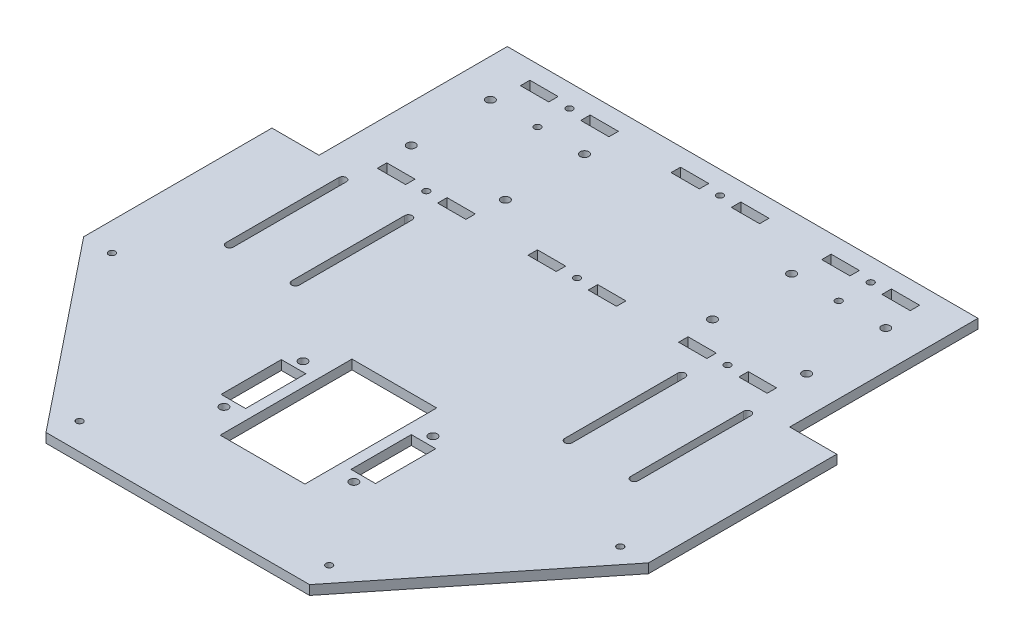
from build123d import *

# Parameters (mm, degrees)
SKETCH_2_R          = 2.25
EXTRUDE_2_DEPTH     = 5
SKETCH_3_W          = 25
SKETCH_3_H          = 100
CUT_EXTRUDE_1_DEPTH = 5
CUT_EXTRUDE_2_DEPTH = 5
SKETCH_5_R          = 1.75
SKETCH_5_W          = 15
SKETCH_5_H          = 5
CUT_EXTRUDE_3_DEPTH = 213.190951739
SKETCH_7_R          = 2.25
SKETCH_7_W          = 13
SKETCH_7_H          = 32
SKETCH_7_W_2        = 45
SKETCH_7_H_2        = 70
CUT_EXTRUDE_4_DEPTH = 10
SKETCH_8_R          = 1.75
CUT_EXTRUDE_5_DEPTH = 213.190951739


with BuildPart() as part:
    # 草圖2 → 填料-伸長2 (new body)
    with BuildSketch(Plane(origin=(0, 0, 0), x_dir=(1, 0, 0), z_dir=(0, 1, 0))):
        Polygon((-150, 150), (150, 150), (150, -50), (70, -150), (-70, -150), (-150, -50), align=None)
        with Locations((-105, 121)):
            Circle(SKETCH_2_R, mode=Mode.SUBTRACT)
        with Locations((-105, 79)):
            Circle(SKETCH_2_R, mode=Mode.SUBTRACT)
        with Locations((-55, 79)):
            Circle(SKETCH_2_R, mode=Mode.SUBTRACT)
        with Locations((-55, 121)):
            Circle(SKETCH_2_R, mode=Mode.SUBTRACT)
        with Locations((55, 121)):
            Circle(SKETCH_2_R, mode=Mode.SUBTRACT)
        with Locations((55, 79)):
            Circle(SKETCH_2_R, mode=Mode.SUBTRACT)
        with Locations((105, 121)):
            Circle(SKETCH_2_R, mode=Mode.SUBTRACT)
        with Locations((105, 79)):
            Circle(SKETCH_2_R, mode=Mode.SUBTRACT)
    extrude(amount=EXTRUDE_2_DEPTH)

    # 草圖3 → 除料-伸長1 (cut)
    with BuildSketch(Plane(origin=(0, 5, 0), x_dir=(1, 0, 0), z_dir=(0, 1, 0))):
        with Locations((-137.5, 100)):
            Rectangle(SKETCH_3_W, SKETCH_3_H)
        with Locations((137.5, 100)):
            Rectangle(SKETCH_3_W, SKETCH_3_H)
    extrude(amount=-CUT_EXTRUDE_1_DEPTH, mode=Mode.SUBTRACT)

    # 草圖4 → 除料-伸長2 (cut)
    with BuildSketch(Plane(origin=(0, 5, 0), x_dir=(1, 0, 0), z_dir=(0, 1, 0))):
        with BuildLine():
            Line((-105.5, 45), (-105.5, -15))
            ThreePointArc((-105.5, -15), (-107.5, -17), (-109.5, -15))
            Line((-109.5, -15), (-109.5, 45))
            ThreePointArc((-109.5, 45), (-107.5, 47), (-105.5, 45))
        make_face()
        with BuildLine():
            Line((-74.5, 45), (-74.5, -15))
            ThreePointArc((-74.5, -15), (-72.5, -17), (-70.5, -15))
            Line((-70.5, -15), (-70.5, 45))
            ThreePointArc((-70.5, 45), (-72.5, 47), (-74.5, 45))
        make_face()
        with BuildLine():
            Line((105.5, 45), (105.5, -15))
            ThreePointArc((105.5, -15), (107.5, -17), (109.5, -15))
            Line((109.5, -15), (109.5, 45))
            ThreePointArc((109.5, 45), (107.5, 47), (105.5, 45))
        make_face()
        with BuildLine():
            Line((74.5, 45), (74.5, -15))
            ThreePointArc((74.5, -15), (72.5, -17), (70.5, -15))
            Line((70.5, -15), (70.5, 45))
            ThreePointArc((70.5, 45), (72.5, 47), (74.5, 45))
        make_face()
    extrude(amount=-CUT_EXTRUDE_2_DEPTH, mode=Mode.SUBTRACT)

    # 草圖5 → 除料-伸長3 (cut, through all)
    with BuildSketch(Plane(origin=(0, 5, 0), x_dir=(1, 0, 0), z_dir=(0, 1, 0))):
        with Locations((0, 62)):
            Circle(SKETCH_5_R)
        with Locations((-80, 62)):
            Circle(SKETCH_5_R)
        with Locations((80, 62)):
            Circle(SKETCH_5_R)
        with Locations((80, 138)):
            Circle(SKETCH_5_R)
        with Locations((-80, 138)):
            Circle(SKETCH_5_R)
        with Locations((0, 138)):
            Circle(SKETCH_5_R)
        with Locations((16, 62)):
            Rectangle(SKETCH_5_W, SKETCH_5_H)
        with Locations((-16, 62)):
            Rectangle(SKETCH_5_W, SKETCH_5_H)
        with Locations((-96, 62)):
            Rectangle(SKETCH_5_W, SKETCH_5_H)
        with Locations((-64, 62)):
            Rectangle(SKETCH_5_W, SKETCH_5_H)
        with Locations((64, 62)):
            Rectangle(SKETCH_5_W, SKETCH_5_H)
        with Locations((96, 62)):
            Rectangle(SKETCH_5_W, SKETCH_5_H)
        with Locations((96, 138)):
            Rectangle(SKETCH_5_W, SKETCH_5_H)
        with Locations((64, 138)):
            Rectangle(SKETCH_5_W, SKETCH_5_H)
        with Locations((-64, 138)):
            Rectangle(SKETCH_5_W, SKETCH_5_H)
        with Locations((-96, 138)):
            Rectangle(SKETCH_5_W, SKETCH_5_H)
        with Locations((16, 138)):
            Rectangle(SKETCH_5_W, SKETCH_5_H)
        with Locations((-16, 138)):
            Rectangle(SKETCH_5_W, SKETCH_5_H)
    extrude(amount=-CUT_EXTRUDE_3_DEPTH, mode=Mode.SUBTRACT)

    # 草圖7 → 除料-伸長4 (cut)
    with BuildSketch(Plane(origin=(0, 5, 0), x_dir=(1, 0, 0), z_dir=(0, 1, 0))):
        with Locations((-34.5, -49)):
            Circle(SKETCH_7_R)
        with Locations((-34.5, -91)):
            Circle(SKETCH_7_R)
        with Locations((34.5, -91)):
            Circle(SKETCH_7_R)
        with Locations((34.5, -49)):
            Circle(SKETCH_7_R)
        with Locations((34.5, -70)):
            Rectangle(SKETCH_7_W, SKETCH_7_H)
        with Locations((0, -70)):
            Rectangle(SKETCH_7_W_2, SKETCH_7_H_2)
        with Locations((-34.5, -70)):
            Rectangle(SKETCH_7_W, SKETCH_7_H)
    extrude(amount=-CUT_EXTRUDE_4_DEPTH, mode=Mode.SUBTRACT)

    # 草圖8 → 除料-伸長5 (cut, through all)
    with BuildSketch(Plane(origin=(0, 5, 0), x_dir=(1, 0, 0), z_dir=(0, 1, 0))):
        with Locations((-80, 121)):
            Circle(SKETCH_8_R)
        with Locations((80, 121)):
            Circle(SKETCH_8_R)
        with Locations((-135, -50)):
            Circle(SKETCH_8_R)
        with Locations((-66.283544769, -135.895569039)):
            Circle(SKETCH_8_R)
        with Locations((135, -50)):
            Circle(SKETCH_8_R)
        with Locations((66.283544769, -135.895569039)):
            Circle(SKETCH_8_R)
    extrude(amount=-CUT_EXTRUDE_5_DEPTH, mode=Mode.SUBTRACT)


solid = part.part
